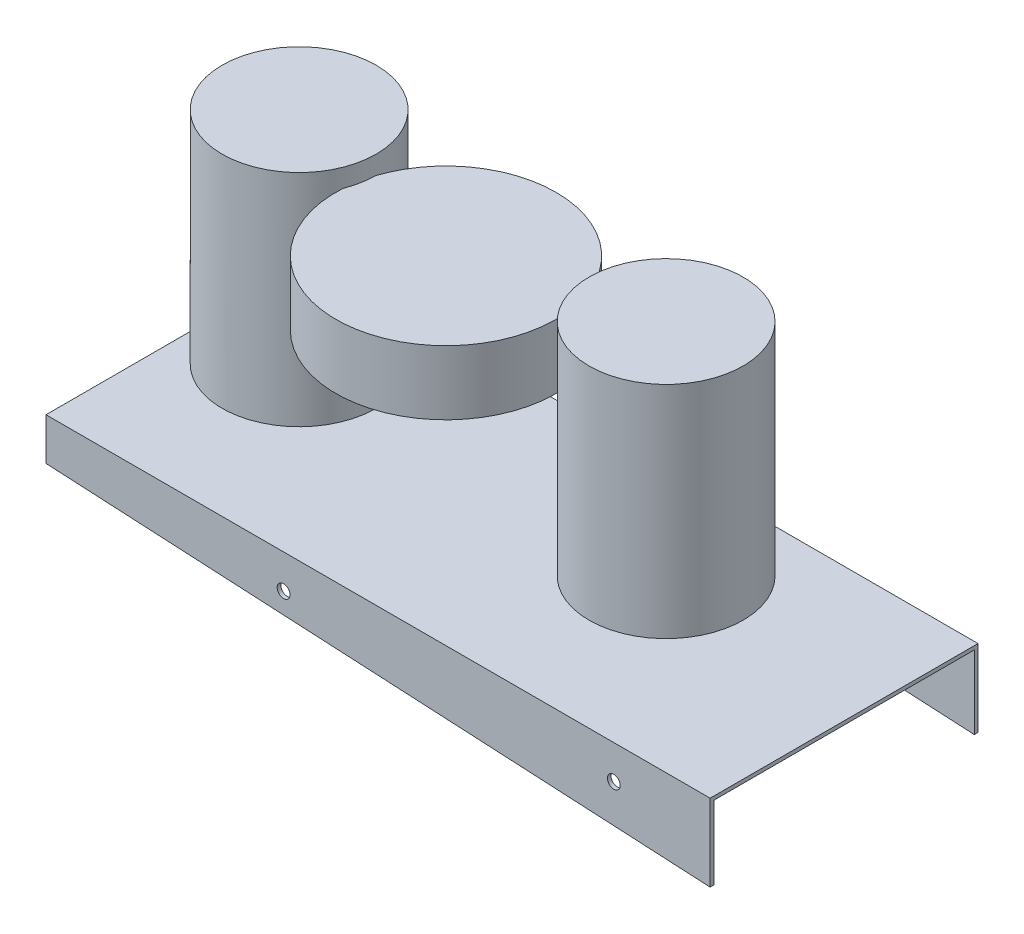
from build123d import *

# Parameters (mm, degrees)
SKETCH1_W               = 362
SKETCH1_H               = 146
BOSS_EXTRUDE1_DEPTH     = 2
SKETCH2_W               = 362
SKETCH2_H               = 2
BOSS_EXTRUDE2_DEPTH     = 42
CUT_EXTRUDE1_DEPTH      = 200.634666328
CUT_EXTRUDE1_DEPTH_BACK = 200.634666328
CUT_EXTRUDE2_DEPTH      = 200.634666328
CUT_EXTRUDE2_DEPTH_BACK = 200.634666328
SKETCH4_R               = 3.5
SKETCH5_R               = 42
BOSS_EXTRUDE3_DEPTH     = 120
BOSS_EXTRUDE4_START     = 75
BOSS_EXTRUDE4_DEPTH     = 35


# Read off the part's stored shape, not the designer's step: Boss-Extrude4
with BuildPart() as part:
    # Sketch1 → Boss-Extrude1 (new body)
    with BuildSketch(Plane(origin=(0, 0, 0), x_dir=(1, 0, 0), z_dir=(0, 1, 0))):
        Rectangle(SKETCH1_W, SKETCH1_H)
    extrude(amount=-BOSS_EXTRUDE1_DEPTH)

    # Sketch2 → Boss-Extrude2 (add)
    with BuildSketch(Plane(origin=(0, 0, 0), x_dir=(1, 0, 0), z_dir=(0, 1, 0))):
        with Locations((0, 72)):
            Rectangle(SKETCH2_W, SKETCH2_H)
        with Locations((0, -72)):
            Rectangle(SKETCH2_W, SKETCH2_H)
    extrude(amount=-BOSS_EXTRUDE2_DEPTH)

    # Sketch3 → Cut-Extrude1 (cut, two sides: drawn at the far end of the back side and taken through both)
    with BuildSketch(Plane.XY.offset(-CUT_EXTRUDE1_DEPTH_BACK)):
        Polygon((-181, -23), (181, -42), (-181, -42), align=None)
    extrude(amount=CUT_EXTRUDE1_DEPTH + CUT_EXTRUDE1_DEPTH_BACK, mode=Mode.SUBTRACT)

    # Sketch4 → Cut-Extrude2 (cut, two sides: drawn at the far end of the back side and taken through both)
    with BuildSketch(Plane.XY.offset(-CUT_EXTRUDE2_DEPTH_BACK)):
        with Locations((128.5, -18.5)):
            Circle(SKETCH4_R)
        with Locations((-51.5, -18.5)):
            Circle(SKETCH4_R)
    extrude(amount=CUT_EXTRUDE2_DEPTH + CUT_EXTRUDE2_DEPTH_BACK, mode=Mode.SUBTRACT)

    # Sketch5 → Boss-Extrude3 (add)
    with BuildSketch(Plane(origin=(0, 0, 0), x_dir=(1, 0, 0), z_dir=(0, 1, 0))):
        with Locations(Location((64, 20, 0), (0, 0, 270))):
            Circle(SKETCH5_R)
        with Locations(Location((-136.025, 20, 0), (0, 0, 90))):
            Circle(SKETCH5_R)
    extrude(amount=BOSS_EXTRUDE3_DEPTH)

    # Boss-Extrude4 outline → Boss-Extrude4 (add)
    with BuildSketch(Plane(origin=(0, 0, 0), x_dir=(1, 0, 0), z_dir=(0, 1, 0)).offset(BOSS_EXTRUDE4_START)):
        with BuildLine():
            ThreePointArc((-94.026421794, 19.654415494), (-94.777390489, 12.085790652), (-96.881019727, 4.776701789))
            add(Edge.make_bspline(
                [(-96.881019727, 4.776701789), (-102.828132782, -89.517000509), (-14.955255925, -54.803487872), (72.917620931, -20.089975236), (4.133007274, 44.681525987), (-64.651606383, 109.45302721), (-94.026421794, 19.654415494)],
                knots=[6.220198638, 6.220198638, 6.220198638, 8.23020693, 8.23020693, 10.240215223, 10.240215223, 12.250223515, 12.250223515, 12.250223515], degree=2, weights=[1, 0.536084715, 1, 0.536084715, 1, 0.536084715, 1]))
        make_face()
    extrude(amount=BOSS_EXTRUDE4_DEPTH)


solid = part.part
